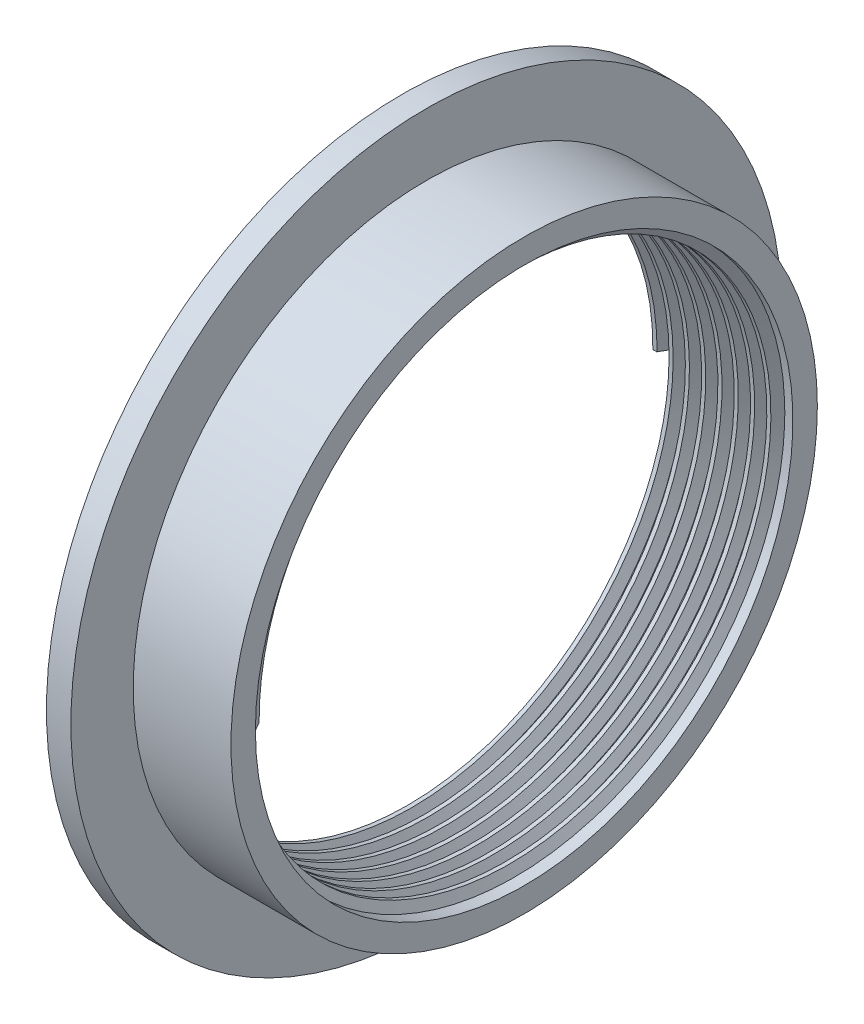
from build123d import *

# Parameters (mm, degrees)
SKETCH1_R           = 23.101481104
SKETCH1_R_2         = 17.4625
BOSS_EXTRUDE1_DEPTH = 0.79375
SKETCH2_R           = 19.05
SKETCH2_R_2         = 17.4625
BOSS_EXTRUDE2_DEPTH = 6.35
THREAD1_PITCH       = 1.058333333


with BuildPart() as part:
    # Sketch1 → Boss-Extrude1 (new, symmetric)
    with BuildSketch(Plane(origin=(0, 0, 0), x_dir=(0, 0, -1), z_dir=(1, 0, 0))):
        Circle(SKETCH1_R)
        Circle(SKETCH1_R_2, mode=Mode.SUBTRACT)
    extrude(amount=BOSS_EXTRUDE1_DEPTH, both=True)

    # Sketch2 → Boss-Extrude2 (add)
    with BuildSketch(Plane(origin=(0.79375, 0, 0), x_dir=(0, 0, -1), z_dir=(1, 0, 0))):
        Circle(SKETCH2_R)
        Circle(SKETCH2_R_2, mode=Mode.SUBTRACT)
    extrude(amount=BOSS_EXTRUDE2_DEPTH)

    # Thread1: the profile of Thread Profile1 profile screwed along a right-hand helix of 7.5 turns, 8 arcs to a turn; built about Z, then put on its axis
    thread1_z = Axis((0, 0, 0), (0, 0, 1))
    thread1_corners = [(17.4628, 0, -0.000173205), (17.4628, 0, 0.926214869), (16.889660282, 0, 0.595312499), (16.889660282, 0, 0.330729165)]
    with BuildLine(mode=Mode.PRIVATE) as thread1_profile:
        Line(thread1_corners[0], thread1_corners[1])
        Line(thread1_corners[1], thread1_corners[2])
        Line(thread1_corners[2], thread1_corners[3])
        Line(thread1_corners[3], thread1_corners[0])
    thread1_cap = Face(thread1_profile.wire())
    thread1_turn_angles = [0, 22.5, 45, 67.5, 90, 112.5, 135, 157.5, 180, 202.5, 225, 247.5, 270, 292.5, 315, 337.5, 360]
    thread1_turn_weights = [1, 0.9238795325112867, 1, 0.9238795325112867, 1, 0.9238795325112867, 1, 0.9238795325112867, 1, 0.9238795325112867, 1, 0.9238795325112867, 1, 0.9238795325112867, 1, 0.9238795325112867, 1]
    thread1_turn_rails = [Edge.make_bspline([Vector(p[0], p[1], 0).rotate(thread1_z, thread1_turn_angles[k]) / thread1_turn_weights[k] + Vector(0, 0, p[2] + THREAD1_PITCH * thread1_turn_angles[k] / 360) for k in range(17)], [0, 0, 0, 1, 1, 2, 2, 3, 3, 4, 4, 5, 5, 6, 6, 7, 7, 8, 8, 8], 2, thread1_turn_weights) for p in thread1_corners]
    thread1_turn_sides = [Face.make_surface_from_curves(thread1_turn_rails[p[0]], thread1_turn_rails[p[1]]) for p in [(0, 1), (1, 2), (2, 3), (3, 0)]]
    thread1_last_angles = [2520, 2542.5, 2565, 2587.5, 2610, 2632.5, 2655, 2677.5, 2700]
    thread1_last_weights = [1, 0.9238795325112867, 1, 0.9238795325112867, 1, 0.9238795325112867, 1, 0.9238795325112852, 1]
    thread1_last_rails = [Edge.make_bspline([Vector(p[0], p[1], 0).rotate(thread1_z, thread1_last_angles[k]) / thread1_last_weights[k] + Vector(0, 0, p[2] + THREAD1_PITCH * thread1_last_angles[k] / 360) for k in range(9)], [0, 0, 0, 1, 1, 2, 2, 3, 3, 4, 4, 4], 2, thread1_last_weights) for p in thread1_corners]
    thread1_last_sides = [Face.make_surface_from_curves(thread1_last_rails[p[0]], thread1_last_rails[p[1]]) for p in [(0, 1), (1, 2), (2, 3), (3, 0)]]
    thread1 = Plane(origin=(7.14375, 0, 0), x_dir=(0, 0, 1), z_dir=(-1, 0, 0)) * Solid(Shell([*[p.moved(Location((0, 0, THREAD1_PITCH * i))) for i in range(7) for p in thread1_turn_sides], *thread1_last_sides, thread1_cap, thread1_cap.rotate(thread1_z, 2700).moved(Location((0, 0, THREAD1_PITCH * 2700 / 360)))]))
    add(thread1)


solid = part.part
